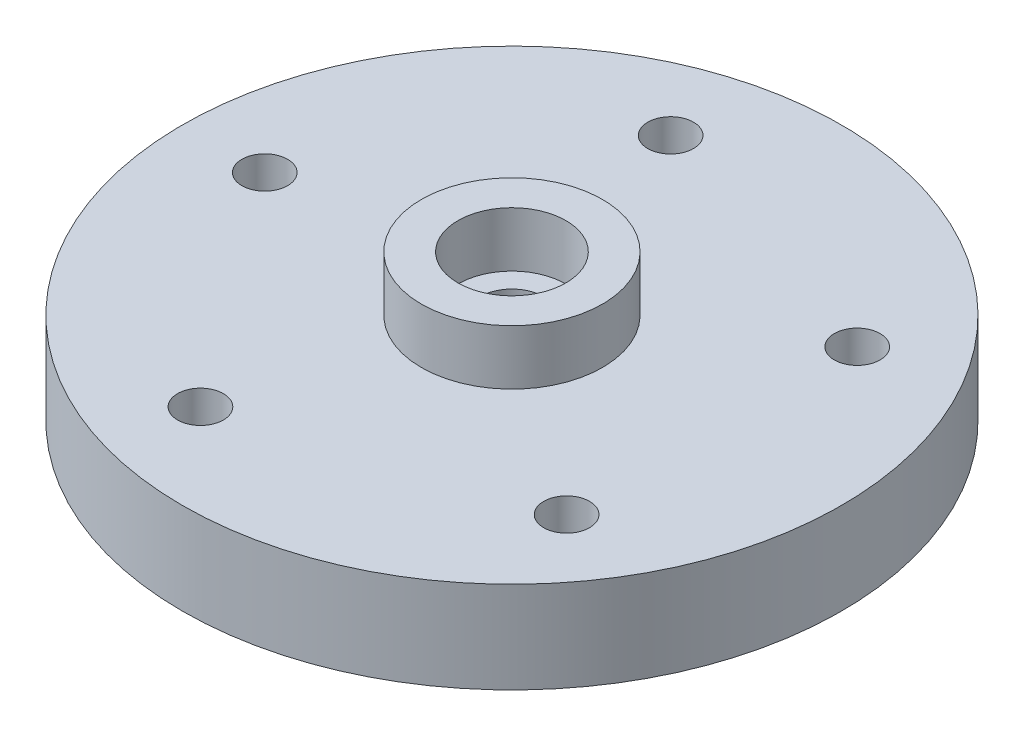
from build123d import *

# Parameters (mm, degrees)
BOSS_EXTRUDE1_DEPTH      = 2
BOSS_EXTRUDE1_DEPTH_BACK = 3
SKETCH1_R                = 16
SKETCH1_R_2              = 1.25
SKETCH1_R_3              = 1.75
SKETCH2_R                = 4.95
SKETCH2_R_2              = 2.95
BOSS_EXTRUDE3_DEPTH      = 3
SKETCH5_R                = 3.5
CUT_EXTRUDE2_DEPTH       = 4
SKETCH6_R                = 18
SKETCH6_R_2              = 16
BOSS_EXTRUDE4_DEPTH      = 5


with BuildPart() as part:
    # Sketch1 → Boss-Extrude1 (new, two sides: drawn at the far end of the back side and taken through both)
    with BuildSketch(Plane(origin=(0, 0, 0), x_dir=(1, 0, 0), z_dir=(0, 1, 0)).offset(-BOSS_EXTRUDE1_DEPTH_BACK)):
        Circle(SKETCH1_R)
        with Locations((-13.5, 0)):
            Circle(SKETCH1_R_2, mode=Mode.SUBTRACT)
        with Locations((-4.171729424, 12.83926297)):
            Circle(SKETCH1_R_2, mode=Mode.SUBTRACT)
        with Locations((10.921729424, 7.935100906)):
            Circle(SKETCH1_R_2, mode=Mode.SUBTRACT)
        Circle(SKETCH1_R_3, mode=Mode.SUBTRACT)
        with Locations((-4.171729424, -12.83926297)):
            Circle(SKETCH1_R_2, mode=Mode.SUBTRACT)
        with Locations((10.921729424, -7.935100906)):
            Circle(SKETCH1_R_2, mode=Mode.SUBTRACT)
    extrude(amount=BOSS_EXTRUDE1_DEPTH + BOSS_EXTRUDE1_DEPTH_BACK)

    # Sketch2 → Boss-Extrude3 (add)
    with BuildSketch(Plane(origin=(0, 2, 0), x_dir=(1, 0, 0), z_dir=(0, 1, 0))):
        Circle(SKETCH2_R)
        Circle(SKETCH2_R_2, mode=Mode.SUBTRACT)
    extrude(amount=BOSS_EXTRUDE3_DEPTH)

    # Sketch5 → Cut-Extrude2 (cut)
    with BuildSketch(Plane.XZ.offset(3)):
        Circle(SKETCH5_R)
    extrude(amount=-CUT_EXTRUDE2_DEPTH, mode=Mode.SUBTRACT)

    # Sketch6 → Boss-Extrude4 (add)
    with BuildSketch(Plane(origin=(0, 2, 0), x_dir=(1, 0, 0), z_dir=(0, 1, 0))):
        Circle(SKETCH6_R)
        Circle(SKETCH6_R_2, mode=Mode.SUBTRACT)
    extrude(amount=-BOSS_EXTRUDE4_DEPTH)


solid = part.part
